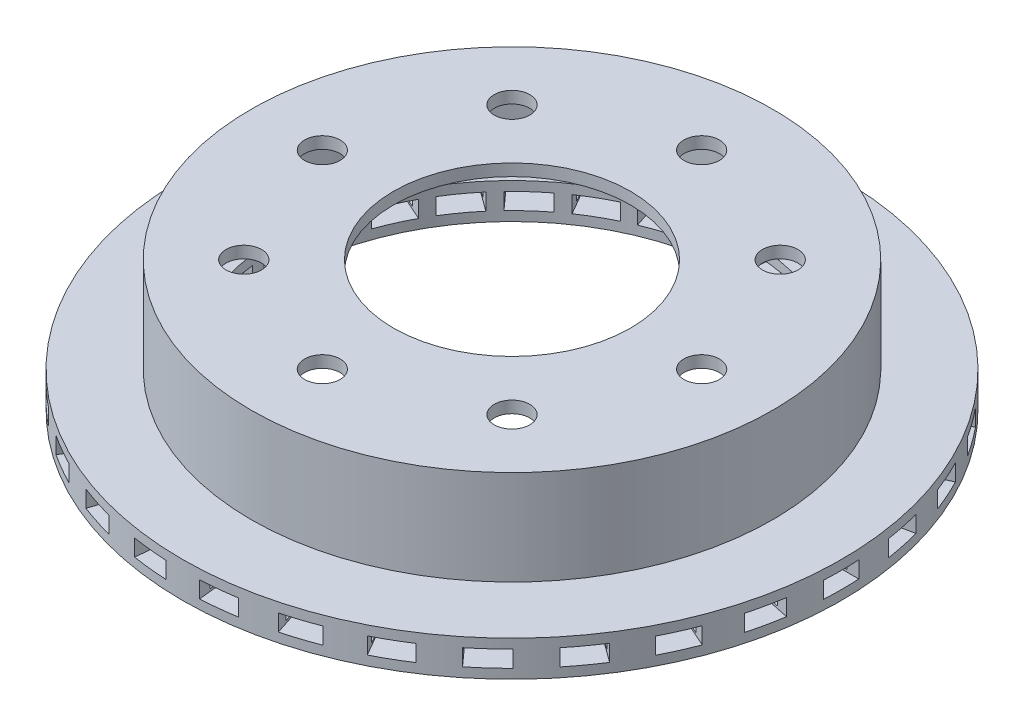
from build123d import *

# Parameters (mm, degrees)
SKETCH1_R               = 139
BOSS_EXTRUDE1_DEPTH     = 7.5
CUT_EXTRUDE1_DEPTH      = 198.147153162
CUT_EXTRUDE1_DEPTH_BACK = 198.147153162
SKETCH2_R               = 97.5
SKETCH3_R               = 110
BOSS_EXTRUDE2_DEPTH     = 40
SHELL1_START            = 7.5
SHELL1_OUTLINE_R        = 105
SHELL1_DEPTH            = 35
SHELL1_START_2          = -2.5
SHELL1_2_OUTLINE_R      = 134
SHELL1_2_OUTLINE_R_2    = 102.5
SHELL1_2_DEPTH          = 5
SHELL1_START_3          = 2.5
SHELL1_3_OUTLINE_R      = 105
SHELL1_3_OUTLINE_R_2    = 102.5
SHELL1_3_DEPTH          = 5
SKETCH5_R               = 50
CUT_EXTRUDE2_DEPTH      = 205.124961727
SKETCH7_R               = 7.5
CUT_EXTRUDE3_DEPTH      = 205.124961727
CIRPATTERN1_COUNT       = 8
SKETCH9_W               = 15
SKETCH9_H               = 7
CUT_EXTRUDE4_DEPTH      = 315.422088919
CIRPATTERN2_COUNT       = 30


# Read off the part's stored shape, not the designer's step: Shell1
with BuildPart() as part:
    # Sketch1 → Boss-Extrude1 (new, symmetric)
    with BuildSketch(Plane(origin=(0, 0, 0), x_dir=(1, 0, 0), z_dir=(0, 1, 0))):
        with Locations(Location((0, 0, 0), (0, 0, 270))):
            Circle(SKETCH1_R)
    extrude(amount=BOSS_EXTRUDE1_DEPTH, both=True)

    # Sketch2 → Cut-Extrude1 (cut, two sides: drawn at the far end of the back side and taken through both)
    with BuildSketch(Plane(origin=(0, 7.5, 0), x_dir=(1, 0, 0), z_dir=(0, 1, 0)).offset(-CUT_EXTRUDE1_DEPTH_BACK)):
        with Locations(Location((0, 0, 0), (0, 0, 270))):
            Circle(SKETCH2_R)
    extrude(amount=CUT_EXTRUDE1_DEPTH + CUT_EXTRUDE1_DEPTH_BACK, mode=Mode.SUBTRACT)

    # Sketch3 → Boss-Extrude2 (add)
    with BuildSketch(Plane(origin=(0, 7.5, 0), x_dir=(1, 0, 0), z_dir=(0, 1, 0))):
        with Locations(Location((0, 0, 0), (0, 0, 270))):
            Circle(SKETCH3_R)
    extrude(amount=BOSS_EXTRUDE2_DEPTH)

    # Shell1 outline → Shell1 (cut)
    with BuildSketch(Plane(origin=(0, 0, 0), x_dir=(1, 0, 0), z_dir=(0, 1, 0)).offset(SHELL1_START)):
        Circle(SHELL1_OUTLINE_R)
    extrude(amount=SHELL1_DEPTH, mode=Mode.SUBTRACT)

    # Shell1 2 outline → Shell1 2 (cut)
    with BuildSketch(Plane(origin=(0, 0, 0), x_dir=(1, 0, 0), z_dir=(0, 1, 0)).offset(SHELL1_START_2)):
        Circle(SHELL1_2_OUTLINE_R)
        Circle(SHELL1_2_OUTLINE_R_2, mode=Mode.SUBTRACT)
    extrude(amount=SHELL1_2_DEPTH, mode=Mode.SUBTRACT)

    # Shell1 3 outline → Shell1 3 (cut)
    with BuildSketch(Plane(origin=(0, 0, 0), x_dir=(1, 0, 0), z_dir=(0, 1, 0)).offset(SHELL1_START_3)):
        Circle(SHELL1_3_OUTLINE_R)
        Circle(SHELL1_3_OUTLINE_R_2, mode=Mode.SUBTRACT)
    extrude(amount=SHELL1_3_DEPTH, mode=Mode.SUBTRACT)

    # Sketch5 → Cut-Extrude2 (cut, through all)
    with BuildSketch(Plane(origin=(0, 47.5, 0), x_dir=(1, 0, 0), z_dir=(0, 1, 0))):
        with Locations(Location((0, 0, 0), (0, 0, 270))):
            Circle(SKETCH5_R)
    extrude(amount=-CUT_EXTRUDE2_DEPTH, mode=Mode.SUBTRACT)

    # Sketch7 → Cut-Extrude3 (cut, symmetric)
    with BuildSketch(Plane(origin=(0, 47.5, 0), x_dir=(1, 0, 0), z_dir=(0, 1, 0))):
        with Locations(Location((0, 80, 0), (0, 0, 270))):
            Circle(SKETCH7_R)
    cut_extrude3 = extrude(amount=CUT_EXTRUDE3_DEPTH, both=True, mode=Mode.SUBTRACT)

    # CirPattern1: Cut-Extrude3 ×8 about axis
    cirpattern1_axis = Axis((0, 0, 0), (0, 1, 0))
    for i in range(1, CIRPATTERN1_COUNT):
        add(cut_extrude3.rotate(cirpattern1_axis, i * 360 / CIRPATTERN1_COUNT), mode=Mode.SUBTRACT)

    # Sketch9 → Cut-Extrude4 (cut, symmetric)
    with BuildSketch(Plane(origin=(139, 0, 0), x_dir=(0, 0, -1), z_dir=(1, 0, 0))):
        Rectangle(SKETCH9_W, SKETCH9_H)
    cut_extrude4 = extrude(amount=CUT_EXTRUDE4_DEPTH, both=True, mode=Mode.SUBTRACT)

    # CirPattern2: Cut-Extrude4 ×30 about axis
    cirpattern2_axis = Axis((0, 0, 0), (0, 1, 0))
    for i in range(1, CIRPATTERN2_COUNT):
        add(cut_extrude4.rotate(cirpattern2_axis, i * 360 / CIRPATTERN2_COUNT), mode=Mode.SUBTRACT)


solid = part.part
